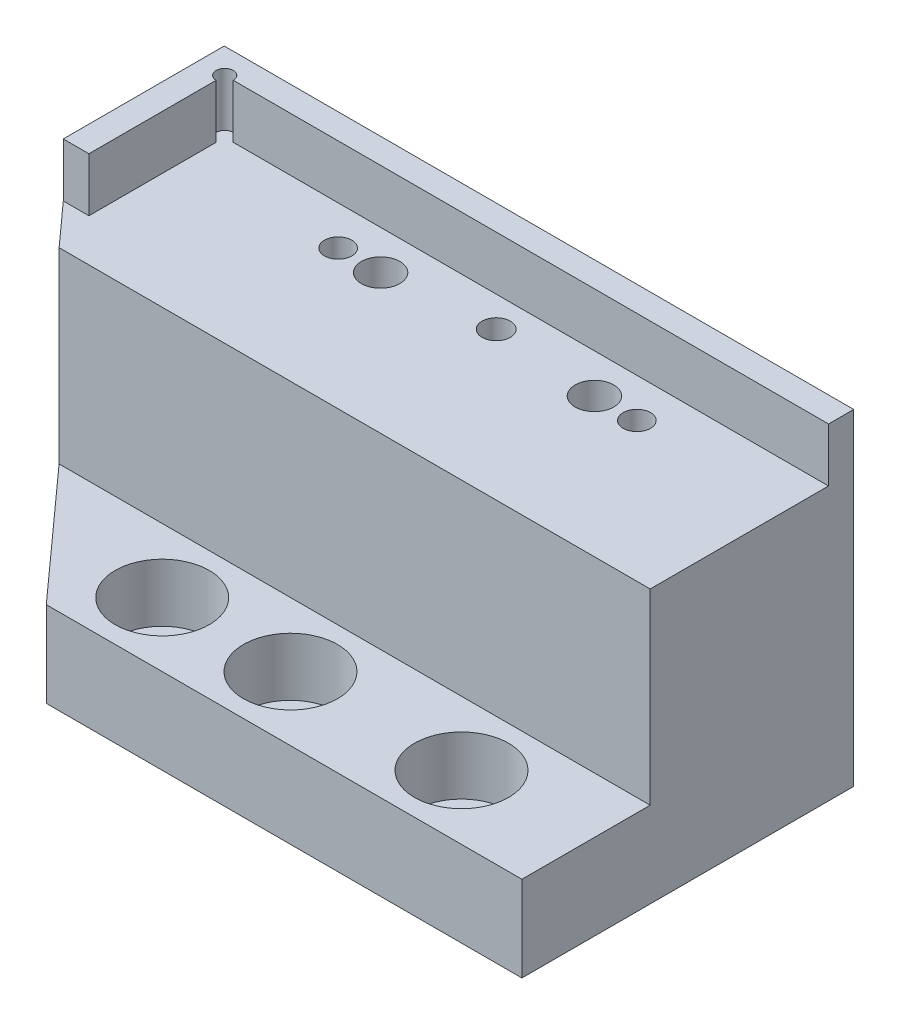
from build123d import *
from build123d.topology import SkipClean

# Parameters (mm, degrees)
SKETCH_1_W                = 76.6
SKETCH_1_H                = 23.8
EXTRUDE_1_DEPTH           = 31.899999991
HOLE_WIZARD_M4_1_D        = 3.3
HOLE_WIZARD_M4_1_DEPTH    = 10.1
HOLE_WIZARD_M4_1_TIP      = 0.991420021
SKETCH_5_W                = 23.8
SKETCH_5_H                = 2.281370048
EXTRUDE_2_DEPTH           = 2.994
SKETCH_6_W                = 76.6
SKETCH_6_H                = 2.281370048
EXTRUDE_3_DEPTH           = 2.944
CUT_EXTRUDE_START         = -2.994
SKETCH_7_W                = 26.992148155
SKETCH_7_H                = 47.339562986
CUT_EXTRUDE_1_DEPTH       = 2.994
EXTRUDE_4_DEPTH           = 10
HOLE_WIZARD_3_D           = 6.6
HOLE_WIZARD_3_CBORE_D     = 11
HOLE_WIZARD_3_CBORE_DEPTH = 6.8
SKETCH_21_R               = 3.3
CUT_EXTRUDE_6_DEPTH       = 67.034934903
MM_2_D                    = 4
MM_2_DEPTH                = 5
MM_2_TIP                  = 1.201721238
CUT_EXTRUDE_7_DEPTH       = 5
SKETCH_26_W               = 46.053862543
SKETCH_26_H               = 10
CUT_EXTRUDE_8_DEPTH       = 76.924939501
CUT_EXTRUDE_9_DEPTH       = 67.034934903
SKETCH_29_R               = 1
CUT_EXTRUDE_10_DEPTH      = 2.281370048
EXTRUDE_START             = 4
EXTRUDE_5_DEPTH           = 4
CUT_EXTRUDE_11_DEPTH      = 0.5
EXTRUDE_6_DEPTH           = 0.499988059
CUT_EXTRUDE_12_DEPTH      = 28.181370038
SKETCH_35_W               = 0.334557313
SKETCH_35_H               = 10
CUT_EXTRUDE_13_DEPTH      = 100.522674932
CHAMFER_1_SIZE            = 2
HOLE_WIZARD_4_D           = 4.5
HOLE_WIZARD_4_CBORE_D     = 8
HOLE_WIZARD_4_CBORE_DEPTH = 25
CUT_EXTRUDE_14_DEPTH      = 67.269104052
CUT_EXTRUDE_15_DEPTH      = 6.281370048
EXTRUDE_9_DEPTH           = 0.006


with BuildPart() as part:
    # 草图1 → 凸台-拉伸1 (new body)
    with BuildSketch(Plane(origin=(0, 0, 0), x_dir=(1, 0, 0), z_dir=(0, 1, 0))):
        Rectangle(SKETCH_1_W, SKETCH_1_H)
    extrude(amount=-EXTRUDE_1_DEPTH)

    # M4 螺纹孔1
    with Locations(Plane(origin=(0, 0, -5.4), x_dir=(0, 0, 1), z_dir=(0, 1, 0))):
        with Locations((0, 0)):
            Hole(HOLE_WIZARD_M4_1_D / 2, depth=HOLE_WIZARD_M4_1_DEPTH)
            with Locations((0, 0, -(HOLE_WIZARD_M4_1_DEPTH + HOLE_WIZARD_M4_1_TIP / 2))):  # 118° drill point
                Cone(0, HOLE_WIZARD_M4_1_D / 2, HOLE_WIZARD_M4_1_TIP, mode=Mode.SUBTRACT)

    # 草图5 → 凸台-拉伸2 (add)
    with BuildSketch(Plane.ZY.offset(38.3)):
        with Locations((0, 1.140685024)):
            Rectangle(SKETCH_5_W, SKETCH_5_H)
    extrude(amount=-EXTRUDE_2_DEPTH)

    # 草图6 → 凸台-拉伸3 (add)
    with BuildSketch(Plane(origin=(0, 0, -11.9), x_dir=(-1, 0, 0), z_dir=(0, 0, -1))):
        with Locations((0, 1.140685024)):
            Rectangle(SKETCH_6_W, SKETCH_6_H)
    extrude(amount=-EXTRUDE_3_DEPTH)

    # 草图7 → 切除-拉伸1 (cut)
    with BuildSketch(Plane(origin=(38.3, 0, 0), x_dir=(0, 0, -1), z_dir=(1, 0, 0)).offset(CUT_EXTRUDE_START)):
        with Locations((-1.596074077, -8.230218498)):
            Rectangle(SKETCH_7_W, SKETCH_7_H)
    extrude(amount=CUT_EXTRUDE_1_DEPTH, mode=Mode.SUBTRACT)

    # 草图9 → 大小mm 暗销孔1 (revolve, cut)
    with BuildSketch(Plane(origin=(17.4625, 0, -4.384), x_dir=(0, 0, 1), z_dir=(1, 0, 0))):
        Polygon((0, 0), (0, 5.96137699), (1.6, 5), (1.6, 0), align=None)
    mm_1 = revolve(axis=Axis((17.4625, 6.35, -4.384), (0, -1, 0)), mode=Mode.SUBTRACT)

    # 镜向3: 大小mm 暗销孔1 across plane
    add(mm_1.mirror(Plane(origin=(0, 0, 0), x_dir=(0, 0, 1), z_dir=(1, 0, 0))), mode=Mode.SUBTRACT)

    # 草图16 → 凸台-拉伸4 (add)
    with BuildSketch(Plane.XZ.offset(31.899999991)):
        Polygon((-38.3, 6.921881597), (-55.247298311, -11.9), (-38.3, -11.9), align=None)
        Polygon((-33.817682057, 11.9), (-20.311621392, 26.9), (35.306, 26.9), (35.306, 11.9), align=None)
    extrude(amount=-EXTRUDE_4_DEPTH)

    # 打孔尺寸(%根据)内六角圆柱头螺钉的类型3 (through all)
    with Locations(Plane(origin=(-14.255841028, -21.899999991, 19.4), x_dir=(1, 0, 0), z_dir=(0, 1, 0))):
        with Locations((0, 0), (15, 0), (35, 0)):
            CounterBoreHole(HOLE_WIZARD_3_D / 2, HOLE_WIZARD_3_CBORE_D / 2, HOLE_WIZARD_3_CBORE_DEPTH)

    # 草图21 → 切除-拉伸6 (cut, through all)
    with BuildSketch(Plane(origin=(0, -21.899999991, 0), x_dir=(1, 0, 0), z_dir=(0, 1, 0))):
        with Locations(Location((-44.3, 5.9, 0), (0, 0, 180))):
            Circle(SKETCH_21_R)
    extrude(amount=-CUT_EXTRUDE_6_DEPTH, mode=Mode.SUBTRACT)

    # 大小mm 暗销孔2
    with Locations(Plane(origin=(10.744158972, -31.899999991, 9.4), x_dir=(0, 0, -1), z_dir=(0, -1, 0))):
        with Locations((0, 0)):
            Hole(MM_2_D / 2, depth=MM_2_DEPTH)
            with Locations((0, 0, -(MM_2_DEPTH + MM_2_TIP / 2))):  # 118° drill point
                Cone(0, MM_2_D / 2, MM_2_TIP, mode=Mode.SUBTRACT)

    # 草图25 → 切除-拉伸7 (cut)
    with BuildSketch(Plane.XZ.offset(31.899999991)):
        with BuildLine():
            Line((-9.755841028, 11.4), (-8.755841028, 11.4))
            ThreePointArc((-8.755841028, 11.4), (-6.755841028, 9.4), (-8.755841028, 7.4))
            Line((-8.755841028, 7.4), (-9.755841028, 7.4))
            ThreePointArc((-9.755841028, 7.4), (-11.755841028, 9.4), (-9.755841028, 11.4))
        make_face()
    extrude(amount=-CUT_EXTRUDE_7_DEPTH, mode=Mode.SUBTRACT)

    # 草图26 → 切除-拉伸8 (cut, through all)
    with BuildSketch(Plane(origin=(-24.593701474, 0, 22.144268272), x_dir=(0.6691306063588817, 0, 0.7431448254773731), z_dir=(-0.7431448254773731, 0, 0.6691306063588817))):
        with Locations((-11.827706241, -26.899999991)):
            Rectangle(SKETCH_26_W, SKETCH_26_H)
    extrude(amount=CUT_EXTRUDE_8_DEPTH, mode=Mode.SUBTRACT)

    # 草图27 → 切除-拉伸9 (cut, through all)
    with BuildSketch(Plane.XZ.offset(21.899999991)):
        Polygon((-38.3, 6.921881597), (-33.817682057, 11.9), (-38.3, 11.9), align=None)
    extrude(amount=-CUT_EXTRUDE_9_DEPTH, mode=Mode.SUBTRACT)

    # 草图29 → 切除-拉伸10 (cut)
    with BuildSketch(Plane(origin=(0, 2.281370048, 0), x_dir=(1, 0, 0), z_dir=(0, 1, 0))):
        with Locations((-35.306, 8.956)):
            Circle(SKETCH_29_R)
    extrude(amount=-CUT_EXTRUDE_10_DEPTH, mode=Mode.SUBTRACT)

    # 草图31 → 凸台-拉伸5 (add)
    with SkipClean():  # the faces are left unmerged after this step: merging them gives an invalid solid
        with BuildSketch(Plane(origin=(0, 2.281370048, 0), x_dir=(1, 0, 0), z_dir=(0, 1, 0)).offset(EXTRUDE_START)):
            with BuildLine():
                Line((-34.306, 8.956), (35.306, 8.956))
                Line((35.306, 8.956), (35.306, 11.9))
                Line((35.306, 11.9), (-38.3, 11.9))
                Line((-38.3, 11.9), (-38.3, -6.921881597))
                Line((-38.3, -6.921881597), (-35.306, -10.247055466))
                Line((-35.306, -10.247055466), (-35.306, 7.956))
                ThreePointArc((-35.306, 7.956), (-36.013106781, 9.663106781), (-34.306, 8.956))
            make_face()
        extrude(amount=-EXTRUDE_5_DEPTH)

    # 草图32 → 切除-拉伸11 (cut)
    with SkipClean():  # the faces are left unmerged after this step: merging them gives an invalid solid
        with BuildSketch(Plane(origin=(-24.593701474, 0, 22.144268272), x_dir=(0.6691306063588817, 0, 0.7431448254773731), z_dir=(-0.7431448254773731, 0, 0.6691306063588817))):
            Polygon((-23.813531784, -21.899999991), (-45.811081642, -21.899999991), (-45.811081642, -31.899999991), (7.49870663, -31.899999991), (7.49870663, -21.899999991), (-11.951824765, -21.899999991), (-11.951824765, 0), (-16.009278942, 0), (-16.009278942, 6.281370048), (-23.813531784, 6.281370048), align=None)
        extrude(amount=-CUT_EXTRUDE_11_DEPTH, mode=Mode.SUBTRACT)

    # 草图33 → 凸台-拉伸6 (add)
    with SkipClean():  # the faces are left unmerged after this step: merging them gives an invalid solid
        with BuildSketch(Plane(origin=(-24.222129061, 0, 21.809702968), x_dir=(0.6691306063588818, 0, 0.743144825477373), z_dir=(-0.743144825477373, 0, 0.6691306063588818))):
            Polygon((-45.36087962, -21.899999991), (-45.36087962, -31.899999991), (6.849670289, -31.899999991), (6.849670289, -21.899999991), (-13.334820655, -21.899999991), (-13.334820655, 0), (-16.564585199, 0), (-16.564585199, 6.281370048), (-21.03904799, 6.281370048), (-21.03904799, -21.899999991), align=None)
        extrude(amount=EXTRUDE_6_DEPTH)

    # 草图34 → 切除-拉伸12 (cut)
    with SkipClean():  # the faces are left unmerged after this step: merging them gives an invalid solid
        with BuildSketch(Plane(origin=(0, 6.281370048, 0), x_dir=(1, 0, 0), z_dir=(0, 1, 0))):
            Polygon((-38.3, -6.174643322), (-38.3, -6.921863751), (-38.671563539, -6.509200635), align=None)
            Polygon((-33.144865692, -11.9), (-33.817665989, -11.9), (-33.516429231, -12.234557313), align=None)
        extrude(amount=-CUT_EXTRUDE_12_DEPTH, mode=Mode.SUBTRACT)

    # 草图35 → 切除-拉伸13 (cut, through all)
    with SkipClean():  # the faces are left unmerged after this step: merging them gives an invalid solid
        with BuildSketch(Plane(origin=(35.306, 0, 0), x_dir=(0, 0, -1), z_dir=(1, 0, 0))):
            with Locations((-27.067278657, -26.899999991)):
                Rectangle(SKETCH_35_W, SKETCH_35_H)
        extrude(amount=-CUT_EXTRUDE_13_DEPTH, mode=Mode.SUBTRACT)

    # 倒角1
    # the kernel refuses this chamfer: 2 mm, written as the material it takes off along each edge
    with BuildSketch(Plane(origin=(-54.946045485, -16.756634015, -11.565442687), x_dir=(0.7244655223975927, 0, -0.6893110378176047), z_dir=(0, -1, 0))) as chamfer_1_piece_1:
        Polygon((CHAMFER_1_SIZE * 0.999621916911, CHAMFER_1_SIZE * 0.0274958766106), (-CHAMFER_1_SIZE * 0.0274958766106, CHAMFER_1_SIZE * 0.999621916911), (0, 0), align=None)
    extrude(amount=20.286731952, mode=Mode.SUBTRACT)
    with BuildSketch(Plane(origin=(-35.677563539, 0, 9.834374504), x_dir=(-0.6893110378176056, 0, -0.7244655223975918), z_dir=(0, 1, 0))) as chamfer_1_piece_2:
        Polygon((CHAMFER_1_SIZE * 0.999621916911, -CHAMFER_1_SIZE * 0.0274958766106), (-CHAMFER_1_SIZE * 0.0274958766106, -CHAMFER_1_SIZE * 0.999621916911), (0, 0), align=None)
    extrude(amount=11.424736024, mode=Mode.SUBTRACT)

    # 打孔尺寸(%根据)内六角圆柱头螺钉的类型4 (through all)
    with Locations(Plane(origin=(12.5, -31.899999991, -4.384), x_dir=(0, 0, -1), z_dir=(0, -1, 0))):
        with Locations((0, 0)):
            hole_wizard_4 = CounterBoreHole(HOLE_WIZARD_4_D / 2, HOLE_WIZARD_4_CBORE_D / 2, HOLE_WIZARD_4_CBORE_DEPTH)

    # 镜向4: 打孔尺寸(%根据)内六角圆柱头螺钉的类型4 across plane
    add(hole_wizard_4.mirror(Plane(origin=(0, 0, 0), x_dir=(0, 0, 1), z_dir=(1, 0, 0))), mode=Mode.SUBTRACT)

    # 草图39 → 切除-拉伸14 (cut, through all)
    with BuildSketch(Plane(origin=(0, -21.899999991, 0), x_dir=(1, 0, 0), z_dir=(0, 1, 0))):
        Polygon((-53.512357727, 11.9), (-53.512357727, 9.97317112), (-53.607784272, 10.079153036), align=None)
    extrude(amount=-CUT_EXTRUDE_14_DEPTH, mode=Mode.SUBTRACT)

    # 草图40 → 切除-拉伸15 (cut)
    with BuildSketch(Plane(origin=(0, 6.281370048, 0), x_dir=(1, 0, 0), z_dir=(0, 1, 0))):
        Polygon((-38.3, -6.921863751), (-35.306, -6.921863751), (-35.306, -8.437692972), (-37.015824752, -8.348084853), align=None)
    extrude(amount=-CUT_EXTRUDE_15_DEPTH, mode=Mode.SUBTRACT)

    # 草图42 → 凸台-拉伸9 (add)
    with BuildSketch(Plane.ZY.offset(38.3)):
        Polygon((-11.9, -21.899999991), (6.921863751, -21.899999991), (6.921863751, 0), (6.921863751, 6.281370048), (-11.9, 6.281370048), align=None)
    extrude(amount=EXTRUDE_9_DEPTH)


solid = part.part
